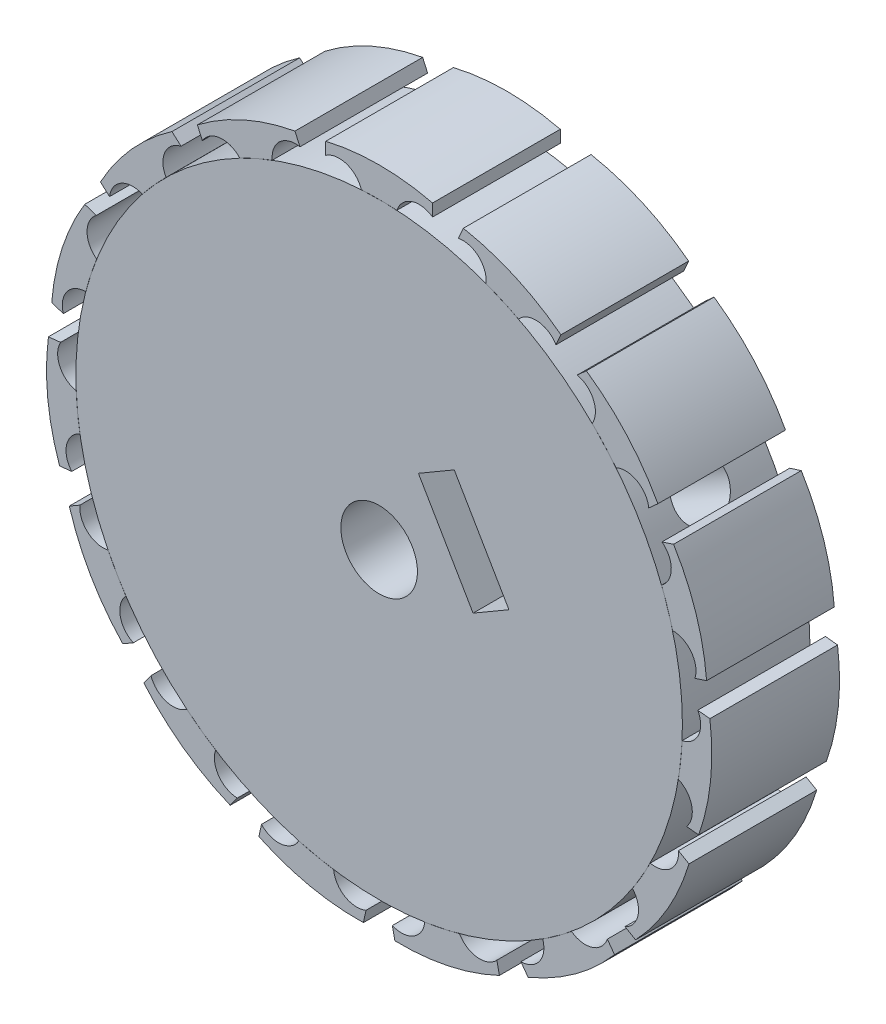
from build123d import *

# Parameters (mm, degrees)
SKETCH1_R                       = 3.048
BOSS_EXTRUDE1_DEPTH             = 10.16
BOSS_EXTRUDE2_REACH             = 36.501
BOSS_EXTRUDE2_DIRECTION_2_REACH = 36.501
CUT_EXTRUDE2_DEPTH              = 9.398
CUT_EXTRUDE4_START              = -14.694949515
CUT_EXTRUDE4_OUTLINE_R          = 2.159
CUT_EXTRUDE4_DEPTH              = 21.978483759


# Read off the part's stored shape, not the designer's step: Cut-Extrude4
with BuildPart() as part:
    # Sketch1 → Boss-Extrude1 (new body)
    with BuildSketch(Plane.XY):
        with BuildLine():
            ThreePointArc((20.897192993, 12.065), (0, 24.13), (-20.897192993, 12.065))
            ThreePointArc((-20.897192993, 12.065), (-20.897192993, -12.065), (0, -24.13))
            ThreePointArc((0, -24.13), (20.897192993, -12.065), (20.897192993, 12.065))
        make_face()
        Circle(SKETCH1_R, mode=Mode.SUBTRACT)
    extrude(amount=BOSS_EXTRUDE1_DEPTH)


with BuildPart() as body_2:

    # Boss-Extrude2: up to this face of the body (flat: up to its plane)
    boss_extrude2_end = Plane(part.part.faces().sort_by_distance((0, 23.447500535, 0))[0])
    # Sketch4 → Boss-Extrude2 (new, up to the picked face)
    with BuildSketch(Plane.XY.offset(5.08), mode=Mode.PRIVATE) as boss_extrude2_sk1:
        with BuildLine():
            Line((4.250474719, 25.041631713), (4.250474719, 26.013777105))
            ThreePointArc((4.250474719, 26.013777105), (0, 26.514790086), (-4.250474719, 26.013777105))
            Line((-4.250474719, 26.013777105), (-4.250474719, 25.041631713))
            ThreePointArc((-4.250474719, 25.041631713), (-2.591037192, 25.282439703), (-1.413595506, 24.088558441))
            ThreePointArc((-1.413595506, 24.088558441), (0, 24.13), (1.413595506, 24.088558441))
            ThreePointArc((1.413595506, 24.088558441), (2.591037192, 25.282439703), (4.250474719, 25.041631713))
        make_face()
    boss_extrude2_tool1 = split(extrude(boss_extrude2_sk1.sketch, amount=-BOSS_EXTRUDE2_REACH, mode=Mode.PRIVATE), bisect_by=boss_extrude2_end, keep=Keep.BOTH, mode=Mode.PRIVATE)
    # Sketch4 → Boss-Extrude2 (new, up to the picked face)
    with BuildSketch(Plane.XY.offset(5.08), mode=Mode.PRIVATE) as boss_extrude2_sk2:
        with BuildLine():
            Line((14.068351093, 21.147845084), (14.463758246, 22.035944092))
            ThreePointArc((14.463758246, 22.035944092), (10.784536711, 24.222466043), (6.697754501, 25.493591729))
            Line((6.697754501, 25.493591729), (6.302347347, 24.605492722))
            ThreePointArc((6.302347347, 24.605492722), (7.916264396, 24.150527718), (8.506315644, 22.580954235))
            ThreePointArc((8.506315644, 22.580954235), (9.814555197, 22.043851893), (11.08908315, 21.431032054))
            ThreePointArc((11.08908315, 21.431032054), (12.650324911, 22.042788179), (14.068351093, 21.147845084))
        make_face()
    boss_extrude2_tool2 = split(extrude(boss_extrude2_sk2.sketch, amount=-BOSS_EXTRUDE2_REACH, mode=Mode.PRIVATE), bisect_by=boss_extrude2_end, keep=Keep.BOTH, mode=Mode.PRIVATE)
    # Sketch4 → Boss-Extrude2 (new, up to the picked face)
    with BuildSketch(Plane.XY.offset(5.08), mode=Mode.PRIVATE) as boss_extrude2_sk3:
        with BuildLine():
            Line((21.453681755, 13.597403919), (22.176126573, 14.247896155))
            ThreePointArc((22.176126573, 14.247896155), (19.704329051, 17.741857568), (16.487881121, 20.565332741))
            Line((16.487881121, 20.565332741), (15.765436303, 19.914840506))
            ThreePointArc((15.765436303, 19.914840506), (17.054771953, 18.842770091), (16.95540754, 17.168897901))
            ThreePointArc((16.95540754, 17.168897901), (17.932084639, 16.146121531), (18.847167576, 15.06788553))
            ThreePointArc((18.847167576, 15.06788553), (20.522256528, 14.991738326), (21.453681755, 13.597403919))
        make_face()
    boss_extrude2_tool3 = split(extrude(boss_extrude2_sk3.sketch, amount=-BOSS_EXTRUDE2_REACH, mode=Mode.PRIVATE), bisect_by=boss_extrude2_end, keep=Keep.BOTH, mode=Mode.PRIVATE)
    # Sketch4 → Boss-Extrude2 (new, up to the picked face)
    with BuildSketch(Plane.XY.offset(5.08), mode=Mode.PRIVATE) as boss_extrude2_sk4:
        with BuildLine():
            Line((25.129475941, 3.695848087), (26.054041152, 3.996257534))
            ThreePointArc((26.054041152, 3.996257534), (25.21706389, 8.193520739), (23.427103307, 12.081140892))
            Line((23.427103307, 12.081140892), (22.502538097, 11.780731445))
            ThreePointArc((22.502538097, 11.780731445), (23.244354502, 10.276926333), (22.472755439, 8.788183145))
            ThreePointArc((22.472755439, 8.788183145), (22.948993738, 7.456580074), (23.346405508, 6.099364711))
            ThreePointArc((23.346405508, 6.099364711), (24.845703553, 5.348480722), (25.129475941, 3.695848087))
        make_face()
    boss_extrude2_tool4 = split(extrude(boss_extrude2_sk4.sketch, amount=-BOSS_EXTRUDE2_REACH, mode=Mode.PRIVATE), bisect_by=boss_extrude2_end, keep=Keep.BOTH, mode=Mode.PRIVATE)
    # Sketch4 → Boss-Extrude2 (new, up to the picked face)
    with BuildSketch(Plane.XY.offset(5.08), mode=Mode.PRIVATE) as boss_extrude2_sk5:
        with BuildLine():
            Line((24.460155443, -6.844753455), (25.426975322, -6.946370319))
            ThreePointArc((25.426975322, -6.946370319), (26.369539292, -2.771550262), (26.315566503, 1.508010029))
            Line((26.315566503, 1.508010029), (25.348746625, 1.609626893))
            ThreePointArc((25.348746625, 1.609626893), (25.414776989, -0.06589135), (24.104359763, -1.112088315))
            ThreePointArc((24.104359763, -1.112088315), (23.997813335, -2.522271819), (23.808837831, -3.923791678))
            ThreePointArc((23.808837831, -3.923791678), (24.873102717, -5.219577789), (24.460155443, -6.844753455))
        make_face()
    boss_extrude2_tool5 = split(extrude(boss_extrude2_sk5.sketch, amount=-BOSS_EXTRUDE2_REACH, mode=Mode.PRIVATE), bisect_by=boss_extrude2_end, keep=Keep.BOTH, mode=Mode.PRIVATE)
    # Sketch4 → Boss-Extrude2 (new, up to the picked face)
    with BuildSketch(Plane.XY.offset(5.08), mode=Mode.PRIVATE) as boss_extrude2_sk6:
        with BuildLine():
            Line((19.561451856, -16.201834941), (20.403354462, -16.687907637))
            ThreePointArc((20.403354462, -16.687907637), (22.962481791, -13.257395043), (24.653829181, -9.325869468))
            Line((24.653829181, -9.325869468), (23.811926575, -8.839796771))
            ThreePointArc((23.811926575, -8.839796771), (23.190753648, -10.397315821), (21.568101303, -10.820069602))
            ThreePointArc((21.568101303, -10.820069602), (20.897192993, -12.065), (20.154505797, -13.268488839))
            ThreePointArc((20.154505797, -13.268488839), (20.599716456, -14.885123882), (19.561451856, -16.201834941))
        make_face()
    boss_extrude2_tool6 = split(extrude(boss_extrude2_sk6.sketch, amount=-BOSS_EXTRUDE2_REACH, mode=Mode.PRIVATE), bisect_by=boss_extrude2_end, keep=Keep.BOTH, mode=Mode.PRIVATE)
    # Sketch4 → Boss-Extrude2 (new, up to the picked face)
    with BuildSketch(Plane.XY.offset(5.08), mode=Mode.PRIVATE) as boss_extrude2_sk7:
        with BuildLine():
            Line((11.280395532, -22.757471978), (11.851808257, -23.543954121))
            ThreePointArc((11.851808257, -23.543954121), (15.58500258, -21.450915782), (18.729220821, -18.547221411))
            Line((18.729220821, -18.547221411), (18.157808096, -17.760739267))
            ThreePointArc((18.157808096, -17.760739267), (16.956838321, -18.930949929), (15.302522188, -18.657162557))
            ThreePointArc((15.302522188, -18.657162557), (14.183258138, -19.521580074), (13.015276613, -20.318943739))
            ThreePointArc((13.015276613, -20.318943739), (12.764452078, -21.976896829), (11.280395532, -22.757471978))
        make_face()
    boss_extrude2_tool7 = split(extrude(boss_extrude2_sk7.sketch, amount=-BOSS_EXTRUDE2_REACH, mode=Mode.PRIVATE), bisect_by=boss_extrude2_end, keep=Keep.BOTH, mode=Mode.PRIVATE)
    # Sketch4 → Boss-Extrude2 (new, up to the picked face)
    with BuildSketch(Plane.XY.offset(5.08), mode=Mode.PRIVATE) as boss_extrude2_sk8:
        with BuildLine():
            Line((1.048856342, -25.378135364), (1.250976734, -26.329037047))
            ThreePointArc((1.250976734, -26.329037047), (5.512734838, -25.935378307), (9.566160031, -24.561590276))
            Line((9.566160031, -24.561590276), (9.364039639, -23.610688593))
            ThreePointArc((9.364039639, -23.610688593), (7.7909316, -24.191250812), (6.390997967, -23.268262612))
            ThreePointArc((6.390997967, -23.268262612), (5.016909099, -23.602701606), (3.625587862, -23.856068676))
            ThreePointArc((3.625587862, -23.856068676), (2.722097973, -25.26866466), (1.048856342, -25.378135364))
        make_face()
    boss_extrude2_tool8 = split(extrude(boss_extrude2_sk8.sketch, amount=-BOSS_EXTRUDE2_REACH, mode=Mode.PRIVATE), bisect_by=boss_extrude2_end, keep=Keep.BOTH, mode=Mode.PRIVATE)
    # Sketch4 → Boss-Extrude2 (new, up to the picked face)
    with BuildSketch(Plane.XY.offset(5.08), mode=Mode.PRIVATE) as boss_extrude2_sk9:
        with BuildLine():
            Line((-9.364039639, -23.610688593), (-9.566160031, -24.561590276))
            ThreePointArc((-9.566160031, -24.561590276), (-5.512734838, -25.935378307), (-1.250976734, -26.329037047))
            Line((-1.250976734, -26.329037047), (-1.048856342, -25.378135364))
            ThreePointArc((-1.048856342, -25.378135364), (-2.722097973, -25.26866466), (-3.625587862, -23.856068676))
            ThreePointArc((-3.625587862, -23.856068676), (-5.016909099, -23.602701606), (-6.390997967, -23.268262612))
            ThreePointArc((-6.390997967, -23.268262612), (-7.7909316, -24.191250812), (-9.364039639, -23.610688593))
        make_face()
    boss_extrude2_tool9 = split(extrude(boss_extrude2_sk9.sketch, amount=-BOSS_EXTRUDE2_REACH, mode=Mode.PRIVATE), bisect_by=boss_extrude2_end, keep=Keep.BOTH, mode=Mode.PRIVATE)
    # Sketch4 → Boss-Extrude2 (new, up to the picked face)
    with BuildSketch(Plane.XY.offset(5.08), mode=Mode.PRIVATE) as boss_extrude2_sk10:
        with BuildLine():
            Line((-18.157808096, -17.760739267), (-18.729220821, -18.547221411))
            ThreePointArc((-18.729220821, -18.547221411), (-15.58500258, -21.450915782), (-11.851808257, -23.543954121))
            Line((-11.851808257, -23.543954121), (-11.280395532, -22.757471978))
            ThreePointArc((-11.280395532, -22.757471978), (-12.764452078, -21.976896829), (-13.015276613, -20.318943739))
            ThreePointArc((-13.015276613, -20.318943739), (-14.183258138, -19.521580074), (-15.302522188, -18.657162557))
            ThreePointArc((-15.302522188, -18.657162557), (-16.956838321, -18.930949929), (-18.157808096, -17.760739267))
        make_face()
    boss_extrude2_tool10 = split(extrude(boss_extrude2_sk10.sketch, amount=-BOSS_EXTRUDE2_REACH, mode=Mode.PRIVATE), bisect_by=boss_extrude2_end, keep=Keep.BOTH, mode=Mode.PRIVATE)
    # Sketch4 → Boss-Extrude2 (new, up to the picked face)
    with BuildSketch(Plane.XY.offset(5.08), mode=Mode.PRIVATE) as boss_extrude2_sk11:
        with BuildLine():
            Line((-23.811926575, -8.839796771), (-24.653829181, -9.325869468))
            ThreePointArc((-24.653829181, -9.325869468), (-22.962481791, -13.257395043), (-20.403354462, -16.687907637))
            Line((-20.403354462, -16.687907637), (-19.561451856, -16.201834941))
            ThreePointArc((-19.561451856, -16.201834941), (-20.599716456, -14.885123882), (-20.154505797, -13.268488839))
            ThreePointArc((-20.154505797, -13.268488839), (-20.897192993, -12.065), (-21.568101303, -10.820069602))
            ThreePointArc((-21.568101303, -10.820069602), (-23.190753648, -10.397315821), (-23.811926575, -8.839796771))
        make_face()
    boss_extrude2_tool11 = split(extrude(boss_extrude2_sk11.sketch, amount=-BOSS_EXTRUDE2_REACH, mode=Mode.PRIVATE), bisect_by=boss_extrude2_end, keep=Keep.BOTH, mode=Mode.PRIVATE)
    # Sketch4 → Boss-Extrude2 (new, up to the picked face)
    with BuildSketch(Plane.XY.offset(5.08), mode=Mode.PRIVATE) as boss_extrude2_sk12:
        with BuildLine():
            Line((-25.348746625, 1.609626893), (-26.315566503, 1.508010029))
            ThreePointArc((-26.315566503, 1.508010029), (-26.369539292, -2.771550262), (-25.426975322, -6.946370319))
            Line((-25.426975322, -6.946370319), (-24.460155443, -6.844753455))
            ThreePointArc((-24.460155443, -6.844753455), (-24.873102717, -5.219577789), (-23.808837831, -3.923791678))
            ThreePointArc((-23.808837831, -3.923791678), (-23.997813335, -2.522271819), (-24.104359763, -1.112088315))
            ThreePointArc((-24.104359763, -1.112088315), (-25.414776989, -0.06589135), (-25.348746625, 1.609626893))
        make_face()
    boss_extrude2_tool12 = split(extrude(boss_extrude2_sk12.sketch, amount=-BOSS_EXTRUDE2_REACH, mode=Mode.PRIVATE), bisect_by=boss_extrude2_end, keep=Keep.BOTH, mode=Mode.PRIVATE)
    # Sketch4 → Boss-Extrude2 (new, up to the picked face)
    with BuildSketch(Plane.XY.offset(5.08), mode=Mode.PRIVATE) as boss_extrude2_sk13:
        with BuildLine():
            Line((-22.502538097, 11.780731445), (-23.427103307, 12.081140892))
            ThreePointArc((-23.427103307, 12.081140892), (-25.21706389, 8.193520739), (-26.054041152, 3.996257534))
            Line((-26.054041152, 3.996257534), (-25.129475941, 3.695848087))
            ThreePointArc((-25.129475941, 3.695848087), (-24.845703553, 5.348480722), (-23.346405508, 6.099364711))
            ThreePointArc((-23.346405508, 6.099364711), (-22.948993738, 7.456580074), (-22.472755439, 8.788183145))
            ThreePointArc((-22.472755439, 8.788183145), (-23.244354502, 10.276926333), (-22.502538097, 11.780731445))
        make_face()
    boss_extrude2_tool13 = split(extrude(boss_extrude2_sk13.sketch, amount=-BOSS_EXTRUDE2_REACH, mode=Mode.PRIVATE), bisect_by=boss_extrude2_end, keep=Keep.BOTH, mode=Mode.PRIVATE)
    # Sketch4 → Boss-Extrude2 (new, up to the picked face)
    with BuildSketch(Plane.XY.offset(5.08), mode=Mode.PRIVATE) as boss_extrude2_sk14:
        with BuildLine():
            Line((-15.765436303, 19.914840506), (-16.487881121, 20.565332741))
            ThreePointArc((-16.487881121, 20.565332741), (-19.704329051, 17.741857568), (-22.176126573, 14.247896155))
            Line((-22.176126573, 14.247896155), (-21.453681755, 13.597403919))
            ThreePointArc((-21.453681755, 13.597403919), (-20.522256528, 14.991738326), (-18.847167576, 15.06788553))
            ThreePointArc((-18.847167576, 15.06788553), (-17.932084639, 16.146121531), (-16.95540754, 17.168897901))
            ThreePointArc((-16.95540754, 17.168897901), (-17.054771953, 18.842770091), (-15.765436303, 19.914840506))
        make_face()
    boss_extrude2_tool14 = split(extrude(boss_extrude2_sk14.sketch, amount=-BOSS_EXTRUDE2_REACH, mode=Mode.PRIVATE), bisect_by=boss_extrude2_end, keep=Keep.BOTH, mode=Mode.PRIVATE)
    # Sketch4 → Boss-Extrude2 (new, up to the picked face)
    with BuildSketch(Plane.XY.offset(5.08), mode=Mode.PRIVATE) as boss_extrude2_sk15:
        with BuildLine():
            Line((-6.302347347, 24.605492722), (-6.697754501, 25.493591729))
            ThreePointArc((-6.697754501, 25.493591729), (-10.784536711, 24.222466043), (-14.463758246, 22.035944092))
            Line((-14.463758246, 22.035944092), (-14.068351093, 21.147845084))
            ThreePointArc((-14.068351093, 21.147845084), (-12.650324911, 22.042788179), (-11.08908315, 21.431032054))
            ThreePointArc((-11.08908315, 21.431032054), (-9.814555197, 22.043851893), (-8.506315644, 22.580954235))
            ThreePointArc((-8.506315644, 22.580954235), (-7.916264396, 24.150527718), (-6.302347347, 24.605492722))
        make_face()
    boss_extrude2_tool15 = split(extrude(boss_extrude2_sk15.sketch, amount=-BOSS_EXTRUDE2_REACH, mode=Mode.PRIVATE), bisect_by=boss_extrude2_end, keep=Keep.BOTH, mode=Mode.PRIVATE)
    add(boss_extrude2_tool1.solids().sort_by(Axis((0, 25.484164, 5.08), (0, 0, -1)))[0])
    add(boss_extrude2_tool2.solids().sort_by(Axis((10.365343, 23.280942, 5.08), (0, 0, -1)))[0])
    add(boss_extrude2_tool3.solids().sort_by(Axis((18.938425, 17.052234, 5.08), (0, 0, -1)))[0])
    add(boss_extrude2_tool4.solids().sort_by(Axis((24.23688, 7.87504, 5.08), (0, 0, -1)))[0])
    add(boss_extrude2_tool5.solids().sort_by(Axis((25.344559, -2.663821, 5.08), (0, 0, -1)))[0])
    add(boss_extrude2_tool6.solids().sort_by(Axis((22.069934, -12.742082, 5.08), (0, 0, -1)))[0])
    add(boss_extrude2_tool7.solids().sort_by(Axis((14.979216, -20.617122, 5.08), (0, 0, -1)))[0])
    add(boss_extrude2_tool8.solids().sort_by(Axis((5.298456, -24.927274, 5.08), (0, 0, -1)))[0])
    add(boss_extrude2_tool9.solids().sort_by(Axis((-5.298456, -24.927274, 5.08), (0, 0, -1)))[0])
    add(boss_extrude2_tool10.solids().sort_by(Axis((-14.979216, -20.617122, 5.08), (0, 0, -1)))[0])
    add(boss_extrude2_tool11.solids().sort_by(Axis((-22.069934, -12.742082, 5.08), (0, 0, -1)))[0])
    add(boss_extrude2_tool12.solids().sort_by(Axis((-25.344559, -2.663821, 5.08), (0, 0, -1)))[0])
    add(boss_extrude2_tool13.solids().sort_by(Axis((-24.23688, 7.87504, 5.08), (0, 0, -1)))[0])
    add(boss_extrude2_tool14.solids().sort_by(Axis((-18.938425, 17.052234, 5.08), (0, 0, -1)))[0])
    add(boss_extrude2_tool15.solids().sort_by(Axis((-10.365343, 23.280942, 5.08), (0, 0, -1)))[0])


    # Boss-Extrude2 direction 2: up to this face of the body (flat: up to its plane)
    boss_extrude2_direction_2_end = Plane(part.part.faces().sort_by_distance((0, 23.447500535, 10.16))[0])
    # Sketch4 → Boss-Extrude2 direction 2 (add, up to the picked face)
    with BuildSketch(Plane.XY.offset(5.08), mode=Mode.PRIVATE) as boss_extrude2_direction_2_sk1:
        with BuildLine():
            Line((4.250474719, 25.041631713), (4.250474719, 26.013777105))
            ThreePointArc((4.250474719, 26.013777105), (0, 26.514790086), (-4.250474719, 26.013777105))
            Line((-4.250474719, 26.013777105), (-4.250474719, 25.041631713))
            ThreePointArc((-4.250474719, 25.041631713), (-2.591037192, 25.282439703), (-1.413595506, 24.088558441))
            ThreePointArc((-1.413595506, 24.088558441), (0, 24.13), (1.413595506, 24.088558441))
            ThreePointArc((1.413595506, 24.088558441), (2.591037192, 25.282439703), (4.250474719, 25.041631713))
        make_face()
    boss_extrude2_direction_2_tool1 = split(extrude(boss_extrude2_direction_2_sk1.sketch, amount=BOSS_EXTRUDE2_DIRECTION_2_REACH, mode=Mode.PRIVATE), bisect_by=boss_extrude2_direction_2_end, keep=Keep.BOTH, mode=Mode.PRIVATE)
    # Sketch4 → Boss-Extrude2 direction 2 (add, up to the picked face)
    with BuildSketch(Plane.XY.offset(5.08), mode=Mode.PRIVATE) as boss_extrude2_direction_2_sk2:
        with BuildLine():
            Line((14.068351093, 21.147845084), (14.463758246, 22.035944092))
            ThreePointArc((14.463758246, 22.035944092), (10.784536711, 24.222466043), (6.697754501, 25.493591729))
            Line((6.697754501, 25.493591729), (6.302347347, 24.605492722))
            ThreePointArc((6.302347347, 24.605492722), (7.916264396, 24.150527718), (8.506315644, 22.580954235))
            ThreePointArc((8.506315644, 22.580954235), (9.814555197, 22.043851893), (11.08908315, 21.431032054))
            ThreePointArc((11.08908315, 21.431032054), (12.650324911, 22.042788179), (14.068351093, 21.147845084))
        make_face()
    boss_extrude2_direction_2_tool2 = split(extrude(boss_extrude2_direction_2_sk2.sketch, amount=BOSS_EXTRUDE2_DIRECTION_2_REACH, mode=Mode.PRIVATE), bisect_by=boss_extrude2_direction_2_end, keep=Keep.BOTH, mode=Mode.PRIVATE)
    # Sketch4 → Boss-Extrude2 direction 2 (add, up to the picked face)
    with BuildSketch(Plane.XY.offset(5.08), mode=Mode.PRIVATE) as boss_extrude2_direction_2_sk3:
        with BuildLine():
            Line((21.453681755, 13.597403919), (22.176126573, 14.247896155))
            ThreePointArc((22.176126573, 14.247896155), (19.704329051, 17.741857568), (16.487881121, 20.565332741))
            Line((16.487881121, 20.565332741), (15.765436303, 19.914840506))
            ThreePointArc((15.765436303, 19.914840506), (17.054771953, 18.842770091), (16.95540754, 17.168897901))
            ThreePointArc((16.95540754, 17.168897901), (17.932084639, 16.146121531), (18.847167576, 15.06788553))
            ThreePointArc((18.847167576, 15.06788553), (20.522256528, 14.991738326), (21.453681755, 13.597403919))
        make_face()
    boss_extrude2_direction_2_tool3 = split(extrude(boss_extrude2_direction_2_sk3.sketch, amount=BOSS_EXTRUDE2_DIRECTION_2_REACH, mode=Mode.PRIVATE), bisect_by=boss_extrude2_direction_2_end, keep=Keep.BOTH, mode=Mode.PRIVATE)
    # Sketch4 → Boss-Extrude2 direction 2 (add, up to the picked face)
    with BuildSketch(Plane.XY.offset(5.08), mode=Mode.PRIVATE) as boss_extrude2_direction_2_sk4:
        with BuildLine():
            Line((25.129475941, 3.695848087), (26.054041152, 3.996257534))
            ThreePointArc((26.054041152, 3.996257534), (25.21706389, 8.193520739), (23.427103307, 12.081140892))
            Line((23.427103307, 12.081140892), (22.502538097, 11.780731445))
            ThreePointArc((22.502538097, 11.780731445), (23.244354502, 10.276926333), (22.472755439, 8.788183145))
            ThreePointArc((22.472755439, 8.788183145), (22.948993738, 7.456580074), (23.346405508, 6.099364711))
            ThreePointArc((23.346405508, 6.099364711), (24.845703553, 5.348480722), (25.129475941, 3.695848087))
        make_face()
    boss_extrude2_direction_2_tool4 = split(extrude(boss_extrude2_direction_2_sk4.sketch, amount=BOSS_EXTRUDE2_DIRECTION_2_REACH, mode=Mode.PRIVATE), bisect_by=boss_extrude2_direction_2_end, keep=Keep.BOTH, mode=Mode.PRIVATE)
    # Sketch4 → Boss-Extrude2 direction 2 (add, up to the picked face)
    with BuildSketch(Plane.XY.offset(5.08), mode=Mode.PRIVATE) as boss_extrude2_direction_2_sk5:
        with BuildLine():
            Line((24.460155443, -6.844753455), (25.426975322, -6.946370319))
            ThreePointArc((25.426975322, -6.946370319), (26.369539292, -2.771550262), (26.315566503, 1.508010029))
            Line((26.315566503, 1.508010029), (25.348746625, 1.609626893))
            ThreePointArc((25.348746625, 1.609626893), (25.414776989, -0.06589135), (24.104359763, -1.112088315))
            ThreePointArc((24.104359763, -1.112088315), (23.997813335, -2.522271819), (23.808837831, -3.923791678))
            ThreePointArc((23.808837831, -3.923791678), (24.873102717, -5.219577789), (24.460155443, -6.844753455))
        make_face()
    boss_extrude2_direction_2_tool5 = split(extrude(boss_extrude2_direction_2_sk5.sketch, amount=BOSS_EXTRUDE2_DIRECTION_2_REACH, mode=Mode.PRIVATE), bisect_by=boss_extrude2_direction_2_end, keep=Keep.BOTH, mode=Mode.PRIVATE)
    # Sketch4 → Boss-Extrude2 direction 2 (add, up to the picked face)
    with BuildSketch(Plane.XY.offset(5.08), mode=Mode.PRIVATE) as boss_extrude2_direction_2_sk6:
        with BuildLine():
            Line((19.561451856, -16.201834941), (20.403354462, -16.687907637))
            ThreePointArc((20.403354462, -16.687907637), (22.962481791, -13.257395043), (24.653829181, -9.325869468))
            Line((24.653829181, -9.325869468), (23.811926575, -8.839796771))
            ThreePointArc((23.811926575, -8.839796771), (23.190753648, -10.397315821), (21.568101303, -10.820069602))
            ThreePointArc((21.568101303, -10.820069602), (20.897192993, -12.065), (20.154505797, -13.268488839))
            ThreePointArc((20.154505797, -13.268488839), (20.599716456, -14.885123882), (19.561451856, -16.201834941))
        make_face()
    boss_extrude2_direction_2_tool6 = split(extrude(boss_extrude2_direction_2_sk6.sketch, amount=BOSS_EXTRUDE2_DIRECTION_2_REACH, mode=Mode.PRIVATE), bisect_by=boss_extrude2_direction_2_end, keep=Keep.BOTH, mode=Mode.PRIVATE)
    # Sketch4 → Boss-Extrude2 direction 2 (add, up to the picked face)
    with BuildSketch(Plane.XY.offset(5.08), mode=Mode.PRIVATE) as boss_extrude2_direction_2_sk7:
        with BuildLine():
            Line((11.280395532, -22.757471978), (11.851808257, -23.543954121))
            ThreePointArc((11.851808257, -23.543954121), (15.58500258, -21.450915782), (18.729220821, -18.547221411))
            Line((18.729220821, -18.547221411), (18.157808096, -17.760739267))
            ThreePointArc((18.157808096, -17.760739267), (16.956838321, -18.930949929), (15.302522188, -18.657162557))
            ThreePointArc((15.302522188, -18.657162557), (14.183258138, -19.521580074), (13.015276613, -20.318943739))
            ThreePointArc((13.015276613, -20.318943739), (12.764452078, -21.976896829), (11.280395532, -22.757471978))
        make_face()
    boss_extrude2_direction_2_tool7 = split(extrude(boss_extrude2_direction_2_sk7.sketch, amount=BOSS_EXTRUDE2_DIRECTION_2_REACH, mode=Mode.PRIVATE), bisect_by=boss_extrude2_direction_2_end, keep=Keep.BOTH, mode=Mode.PRIVATE)
    # Sketch4 → Boss-Extrude2 direction 2 (add, up to the picked face)
    with BuildSketch(Plane.XY.offset(5.08), mode=Mode.PRIVATE) as boss_extrude2_direction_2_sk8:
        with BuildLine():
            Line((1.048856342, -25.378135364), (1.250976734, -26.329037047))
            ThreePointArc((1.250976734, -26.329037047), (5.512734838, -25.935378307), (9.566160031, -24.561590276))
            Line((9.566160031, -24.561590276), (9.364039639, -23.610688593))
            ThreePointArc((9.364039639, -23.610688593), (7.7909316, -24.191250812), (6.390997967, -23.268262612))
            ThreePointArc((6.390997967, -23.268262612), (5.016909099, -23.602701606), (3.625587862, -23.856068676))
            ThreePointArc((3.625587862, -23.856068676), (2.722097973, -25.26866466), (1.048856342, -25.378135364))
        make_face()
    boss_extrude2_direction_2_tool8 = split(extrude(boss_extrude2_direction_2_sk8.sketch, amount=BOSS_EXTRUDE2_DIRECTION_2_REACH, mode=Mode.PRIVATE), bisect_by=boss_extrude2_direction_2_end, keep=Keep.BOTH, mode=Mode.PRIVATE)
    # Sketch4 → Boss-Extrude2 direction 2 (add, up to the picked face)
    with BuildSketch(Plane.XY.offset(5.08), mode=Mode.PRIVATE) as boss_extrude2_direction_2_sk9:
        with BuildLine():
            Line((-9.364039639, -23.610688593), (-9.566160031, -24.561590276))
            ThreePointArc((-9.566160031, -24.561590276), (-5.512734838, -25.935378307), (-1.250976734, -26.329037047))
            Line((-1.250976734, -26.329037047), (-1.048856342, -25.378135364))
            ThreePointArc((-1.048856342, -25.378135364), (-2.722097973, -25.26866466), (-3.625587862, -23.856068676))
            ThreePointArc((-3.625587862, -23.856068676), (-5.016909099, -23.602701606), (-6.390997967, -23.268262612))
            ThreePointArc((-6.390997967, -23.268262612), (-7.7909316, -24.191250812), (-9.364039639, -23.610688593))
        make_face()
    boss_extrude2_direction_2_tool9 = split(extrude(boss_extrude2_direction_2_sk9.sketch, amount=BOSS_EXTRUDE2_DIRECTION_2_REACH, mode=Mode.PRIVATE), bisect_by=boss_extrude2_direction_2_end, keep=Keep.BOTH, mode=Mode.PRIVATE)
    # Sketch4 → Boss-Extrude2 direction 2 (add, up to the picked face)
    with BuildSketch(Plane.XY.offset(5.08), mode=Mode.PRIVATE) as boss_extrude2_direction_2_sk10:
        with BuildLine():
            Line((-18.157808096, -17.760739267), (-18.729220821, -18.547221411))
            ThreePointArc((-18.729220821, -18.547221411), (-15.58500258, -21.450915782), (-11.851808257, -23.543954121))
            Line((-11.851808257, -23.543954121), (-11.280395532, -22.757471978))
            ThreePointArc((-11.280395532, -22.757471978), (-12.764452078, -21.976896829), (-13.015276613, -20.318943739))
            ThreePointArc((-13.015276613, -20.318943739), (-14.183258138, -19.521580074), (-15.302522188, -18.657162557))
            ThreePointArc((-15.302522188, -18.657162557), (-16.956838321, -18.930949929), (-18.157808096, -17.760739267))
        make_face()
    boss_extrude2_direction_2_tool10 = split(extrude(boss_extrude2_direction_2_sk10.sketch, amount=BOSS_EXTRUDE2_DIRECTION_2_REACH, mode=Mode.PRIVATE), bisect_by=boss_extrude2_direction_2_end, keep=Keep.BOTH, mode=Mode.PRIVATE)
    # Sketch4 → Boss-Extrude2 direction 2 (add, up to the picked face)
    with BuildSketch(Plane.XY.offset(5.08), mode=Mode.PRIVATE) as boss_extrude2_direction_2_sk11:
        with BuildLine():
            Line((-23.811926575, -8.839796771), (-24.653829181, -9.325869468))
            ThreePointArc((-24.653829181, -9.325869468), (-22.962481791, -13.257395043), (-20.403354462, -16.687907637))
            Line((-20.403354462, -16.687907637), (-19.561451856, -16.201834941))
            ThreePointArc((-19.561451856, -16.201834941), (-20.599716456, -14.885123882), (-20.154505797, -13.268488839))
            ThreePointArc((-20.154505797, -13.268488839), (-20.897192993, -12.065), (-21.568101303, -10.820069602))
            ThreePointArc((-21.568101303, -10.820069602), (-23.190753648, -10.397315821), (-23.811926575, -8.839796771))
        make_face()
    boss_extrude2_direction_2_tool11 = split(extrude(boss_extrude2_direction_2_sk11.sketch, amount=BOSS_EXTRUDE2_DIRECTION_2_REACH, mode=Mode.PRIVATE), bisect_by=boss_extrude2_direction_2_end, keep=Keep.BOTH, mode=Mode.PRIVATE)
    # Sketch4 → Boss-Extrude2 direction 2 (add, up to the picked face)
    with BuildSketch(Plane.XY.offset(5.08), mode=Mode.PRIVATE) as boss_extrude2_direction_2_sk12:
        with BuildLine():
            Line((-25.348746625, 1.609626893), (-26.315566503, 1.508010029))
            ThreePointArc((-26.315566503, 1.508010029), (-26.369539292, -2.771550262), (-25.426975322, -6.946370319))
            Line((-25.426975322, -6.946370319), (-24.460155443, -6.844753455))
            ThreePointArc((-24.460155443, -6.844753455), (-24.873102717, -5.219577789), (-23.808837831, -3.923791678))
            ThreePointArc((-23.808837831, -3.923791678), (-23.997813335, -2.522271819), (-24.104359763, -1.112088315))
            ThreePointArc((-24.104359763, -1.112088315), (-25.414776989, -0.06589135), (-25.348746625, 1.609626893))
        make_face()
    boss_extrude2_direction_2_tool12 = split(extrude(boss_extrude2_direction_2_sk12.sketch, amount=BOSS_EXTRUDE2_DIRECTION_2_REACH, mode=Mode.PRIVATE), bisect_by=boss_extrude2_direction_2_end, keep=Keep.BOTH, mode=Mode.PRIVATE)
    # Sketch4 → Boss-Extrude2 direction 2 (add, up to the picked face)
    with BuildSketch(Plane.XY.offset(5.08), mode=Mode.PRIVATE) as boss_extrude2_direction_2_sk13:
        with BuildLine():
            Line((-22.502538097, 11.780731445), (-23.427103307, 12.081140892))
            ThreePointArc((-23.427103307, 12.081140892), (-25.21706389, 8.193520739), (-26.054041152, 3.996257534))
            Line((-26.054041152, 3.996257534), (-25.129475941, 3.695848087))
            ThreePointArc((-25.129475941, 3.695848087), (-24.845703553, 5.348480722), (-23.346405508, 6.099364711))
            ThreePointArc((-23.346405508, 6.099364711), (-22.948993738, 7.456580074), (-22.472755439, 8.788183145))
            ThreePointArc((-22.472755439, 8.788183145), (-23.244354502, 10.276926333), (-22.502538097, 11.780731445))
        make_face()
    boss_extrude2_direction_2_tool13 = split(extrude(boss_extrude2_direction_2_sk13.sketch, amount=BOSS_EXTRUDE2_DIRECTION_2_REACH, mode=Mode.PRIVATE), bisect_by=boss_extrude2_direction_2_end, keep=Keep.BOTH, mode=Mode.PRIVATE)
    # Sketch4 → Boss-Extrude2 direction 2 (add, up to the picked face)
    with BuildSketch(Plane.XY.offset(5.08), mode=Mode.PRIVATE) as boss_extrude2_direction_2_sk14:
        with BuildLine():
            Line((-15.765436303, 19.914840506), (-16.487881121, 20.565332741))
            ThreePointArc((-16.487881121, 20.565332741), (-19.704329051, 17.741857568), (-22.176126573, 14.247896155))
            Line((-22.176126573, 14.247896155), (-21.453681755, 13.597403919))
            ThreePointArc((-21.453681755, 13.597403919), (-20.522256528, 14.991738326), (-18.847167576, 15.06788553))
            ThreePointArc((-18.847167576, 15.06788553), (-17.932084639, 16.146121531), (-16.95540754, 17.168897901))
            ThreePointArc((-16.95540754, 17.168897901), (-17.054771953, 18.842770091), (-15.765436303, 19.914840506))
        make_face()
    boss_extrude2_direction_2_tool14 = split(extrude(boss_extrude2_direction_2_sk14.sketch, amount=BOSS_EXTRUDE2_DIRECTION_2_REACH, mode=Mode.PRIVATE), bisect_by=boss_extrude2_direction_2_end, keep=Keep.BOTH, mode=Mode.PRIVATE)
    # Sketch4 → Boss-Extrude2 direction 2 (add, up to the picked face)
    with BuildSketch(Plane.XY.offset(5.08), mode=Mode.PRIVATE) as boss_extrude2_direction_2_sk15:
        with BuildLine():
            Line((-6.302347347, 24.605492722), (-6.697754501, 25.493591729))
            ThreePointArc((-6.697754501, 25.493591729), (-10.784536711, 24.222466043), (-14.463758246, 22.035944092))
            Line((-14.463758246, 22.035944092), (-14.068351093, 21.147845084))
            ThreePointArc((-14.068351093, 21.147845084), (-12.650324911, 22.042788179), (-11.08908315, 21.431032054))
            ThreePointArc((-11.08908315, 21.431032054), (-9.814555197, 22.043851893), (-8.506315644, 22.580954235))
            ThreePointArc((-8.506315644, 22.580954235), (-7.916264396, 24.150527718), (-6.302347347, 24.605492722))
        make_face()
    boss_extrude2_direction_2_tool15 = split(extrude(boss_extrude2_direction_2_sk15.sketch, amount=BOSS_EXTRUDE2_DIRECTION_2_REACH, mode=Mode.PRIVATE), bisect_by=boss_extrude2_direction_2_end, keep=Keep.BOTH, mode=Mode.PRIVATE)
    add(boss_extrude2_direction_2_tool1.solids().sort_by(Axis((0, 25.484164, 5.08), (0, 0, 1)))[0])
    add(boss_extrude2_direction_2_tool2.solids().sort_by(Axis((10.365343, 23.280942, 5.08), (0, 0, 1)))[0])
    add(boss_extrude2_direction_2_tool3.solids().sort_by(Axis((18.938425, 17.052234, 5.08), (0, 0, 1)))[0])
    add(boss_extrude2_direction_2_tool4.solids().sort_by(Axis((24.23688, 7.87504, 5.08), (0, 0, 1)))[0])
    add(boss_extrude2_direction_2_tool5.solids().sort_by(Axis((25.344559, -2.663821, 5.08), (0, 0, 1)))[0])
    add(boss_extrude2_direction_2_tool6.solids().sort_by(Axis((22.069934, -12.742082, 5.08), (0, 0, 1)))[0])
    add(boss_extrude2_direction_2_tool7.solids().sort_by(Axis((14.979216, -20.617122, 5.08), (0, 0, 1)))[0])
    add(boss_extrude2_direction_2_tool8.solids().sort_by(Axis((5.298456, -24.927274, 5.08), (0, 0, 1)))[0])
    add(boss_extrude2_direction_2_tool9.solids().sort_by(Axis((-5.298456, -24.927274, 5.08), (0, 0, 1)))[0])
    add(boss_extrude2_direction_2_tool10.solids().sort_by(Axis((-14.979216, -20.617122, 5.08), (0, 0, 1)))[0])
    add(boss_extrude2_direction_2_tool11.solids().sort_by(Axis((-22.069934, -12.742082, 5.08), (0, 0, 1)))[0])
    add(boss_extrude2_direction_2_tool12.solids().sort_by(Axis((-25.344559, -2.663821, 5.08), (0, 0, 1)))[0])
    add(boss_extrude2_direction_2_tool13.solids().sort_by(Axis((-24.23688, 7.87504, 5.08), (0, 0, 1)))[0])
    add(boss_extrude2_direction_2_tool14.solids().sort_by(Axis((-18.938425, 17.052234, 5.08), (0, 0, 1)))[0])
    add(boss_extrude2_direction_2_tool15.solids().sort_by(Axis((-10.365343, 23.280942, 5.08), (0, 0, 1)))[0])


with BuildPart() as part_1:
    add(part.part)

    # Sketch6 → Cut-Extrude2 (cut)
    with BuildSketch(Plane.XY.offset(10.16)):
        Polygon((7.473198082, -0.640893059), (10.325699245, 1.022369131), (5.975628903, 8.48275679), (3.12312774, 6.8194946), align=None)
    extrude(amount=-CUT_EXTRUDE2_DEPTH, mode=Mode.SUBTRACT)

    # Cut-Extrude4 outline → Cut-Extrude4 (cut)
    with BuildSketch(Plane(origin=(8.150664074, 4.75256296, 0), x_dir=(0, 0, 1), z_dir=(-0.8638707340073589, -0.5037135643652917, 0)).offset(CUT_EXTRUDE4_START)):
        with Locations((5.461, 0)):
            Circle(CUT_EXTRUDE4_OUTLINE_R)
    extrude(amount=CUT_EXTRUDE4_DEPTH, mode=Mode.SUBTRACT)


solid = Compound([body_2.part, part_1.part])
